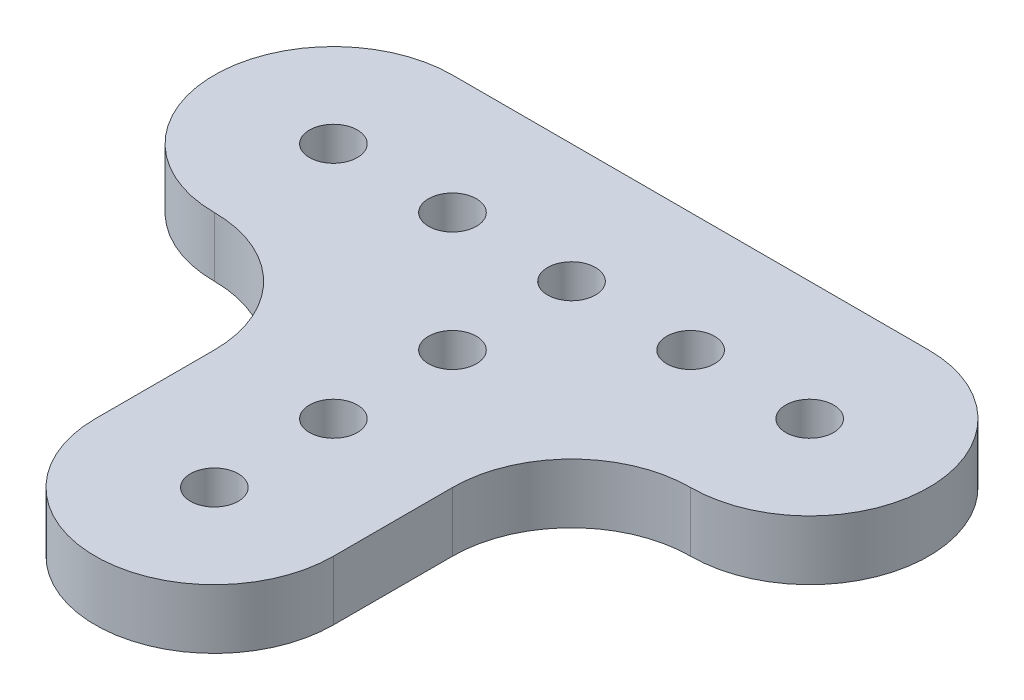
from build123d import *

# Parameters (mm, degrees)
SKETCH1_R           = 2.5527
BOSS_EXTRUDE1_DEPTH = 3.175
FILLET1_R           = 12.7


with BuildPart() as part:
    # Sketch1 → Boss-Extrude1 (new, symmetric)
    # profile 1 of 4: a face of its own
    with BuildSketch(Plane(origin=(0, 0, 0), x_dir=(1, 0, 0), z_dir=(0, 1, 0))):
        with BuildLine():
            Line((25.4, 12.7), (0, 12.7))
            ThreePointArc((0, 12.7), (-12.7, 0), (0, -12.7))
            Line((0, -12.7), (12.7, -12.7))
            Line((12.7, -12.7), (12.7, -2.5527))
            ThreePointArc((12.7, -2.5527), (10.15053309, 0.128435844), (12.95654635, 2.539775829))
            ThreePointArc((12.95654635, 2.539775829), (17.367726132, 9.837305348), (25.4, 12.7))
        make_face()
        with Locations(Location((0, 0, 0), (0, 0, 270))):
            Circle(SKETCH1_R, mode=Mode.SUBTRACT)
    # profile 2 of 4: a face of its own
    with BuildSketch(Plane(origin=(0, 0, 0), x_dir=(1, 0, 0), z_dir=(0, 1, 0))):
        with BuildLine():
            ThreePointArc((37.84345365, 2.539775829), (33.432273868, 9.837305348), (25.4, 12.7))
            ThreePointArc((25.4, 12.7), (17.367726132, 9.837305348), (12.95654635, 2.539775829))
            ThreePointArc((12.95654635, 2.539775829), (14.593563196, 1.711927484), (15.2527, 0))
            ThreePointArc((15.2527, 0), (14.50503148, -1.80503148), (12.7, -2.5527))
            Line((12.7, -2.5527), (12.7, -12.7))
            Line((12.7, -12.7), (22.8473, -12.7))
            ThreePointArc((22.8473, -12.7), (25.4, -10.1473), (27.9527, -12.7))
            Line((27.9527, -12.7), (38.1, -12.7))
            Line((38.1, -12.7), (38.1, -2.5527))
            ThreePointArc((38.1, -2.5527), (35.55053309, -0.128435844), (37.84345365, 2.539775829))
        make_face()
        with Locations(Location((25.4, 0, 0), (0, 0, 270))):
            Circle(SKETCH1_R, mode=Mode.SUBTRACT)
    # profile 3 of 4: a face of its own
    with BuildSketch(Plane(origin=(0, 0, 0), x_dir=(1, 0, 0), z_dir=(0, 1, 0))):
        with BuildLine():
            Line((50.8, 12.7), (25.4, 12.7))
            ThreePointArc((25.4, 12.7), (33.432273868, 9.837305348), (37.84345365, 2.539775829))
            ThreePointArc((37.84345365, 2.539775829), (39.811927484, 1.893563196), (40.6527, 0))
            ThreePointArc((40.6527, 0), (39.90503148, -1.80503148), (38.1, -2.5527))
            Line((38.1, -2.5527), (38.1, -12.7))
            Line((38.1, -12.7), (50.8, -12.7))
            ThreePointArc((50.8, -12.7), (63.5, 0), (50.8, 12.7))
        make_face()
        with Locations(Location((50.8, 0, 0), (0, 0, 270))):
            Circle(SKETCH1_R, mode=Mode.SUBTRACT)
    # profile 4 of 4: a face of its own
    with BuildSketch(Plane(origin=(0, 0, 0), x_dir=(1, 0, 0), z_dir=(0, 1, 0))):
        with BuildLine():
            Line((22.8473, -12.7), (12.7, -12.7))
            Line((12.7, -12.7), (12.7, -38.1))
            ThreePointArc((12.7, -38.1), (25.4, -50.8), (38.1, -38.1))
            Line((38.1, -38.1), (38.1, -12.7))
            Line((38.1, -12.7), (27.9527, -12.7))
            ThreePointArc((27.9527, -12.7), (25.4, -15.2527), (22.8473, -12.7))
        make_face()
        with Locations(Location((25.4, -38.1, 0), (0, 0, 270))):
            Circle(SKETCH1_R, mode=Mode.SUBTRACT)
        with Locations(Location((25.4, -25.4, 0), (0, 0, 270))):
            Circle(SKETCH1_R, mode=Mode.SUBTRACT)
    extrude(amount=BOSS_EXTRUDE1_DEPTH, both=True)

    # Fillet1
    fillet1_edges = [part.edges().sort_by_distance(p)[0] for p in [
        (12.7, 0, 12.7),
        (38.1, 0, 12.7),
    ]]
    fillet(fillet1_edges, radius=FILLET1_R - 0.0001)  # a hair under: the kernel refuses the full size


solid = part.part
